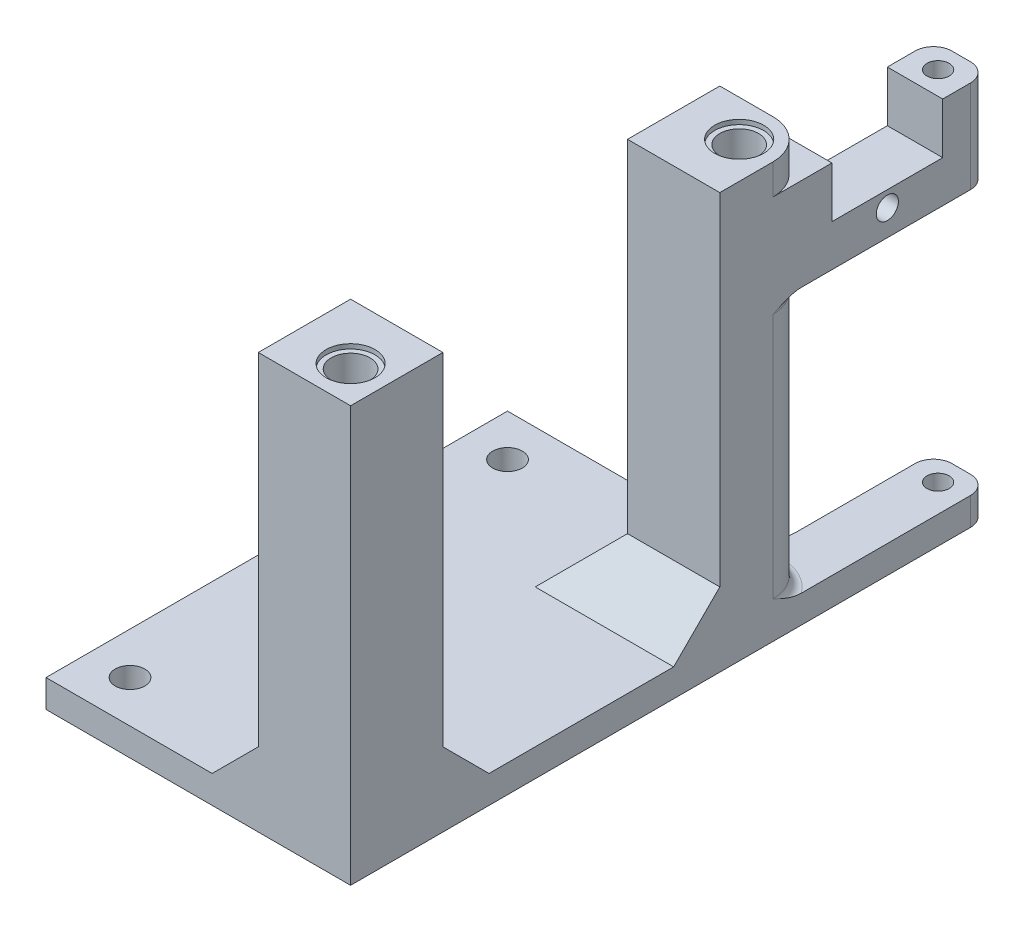
from build123d import *

# Parameters (mm, degrees)
SKETCH1_R           = 1.5999999999999974
SKETCH1_R_2         = 1.6
BOSS_EXTRUDE1_DEPTH = 3
SKETCH2_W           = 10.000000000000004
SKETCH2_H           = 10.000000000000004
BOSS_EXTRUDE2_DEPTH = 42
CHAMFER1_SIZE       = 5
SKETCH3_R           = 2.1
SKETCH3_R_2         = 2.1000000000000005
CUT_EXTRUDE1_DEPTH  = 52.00000000000001
SKETCH4_R           = 2.65
SKETCH4_R_2         = 2.6500000000000004
CUT_EXTRUDE2_DEPTH  = 0.5
BOSS_EXTRUDE3_DEPTH = 14.15
SKETCH6_R           = 1.2000000000000004
CUT_EXTRUDE3_DEPTH  = 6
SKETCH7_W           = 6
SKETCH7_H           = 10.018921584932333
BOSS_EXTRUDE4_DEPTH = 5
BOSS_EXTRUDE5_DEPTH = 2.15
SKETCH9_W           = 6
SKETCH9_H           = 3
BOSS_EXTRUDE6_DEPTH = 19.15
SKETCH10_R          = 1.2000000000000004
CUT_EXTRUDE4_DEPTH  = 64.7666045986287
FILLET3_R           = 2
FILLET4_R           = 4.25
FILLET5_R           = 4.25
FILLET6_R           = 4.25
FILLET7_R           = 4.25
FILLET8_R           = 1
FILLET9_R           = 1


with BuildPart() as part:
    # Sketch1 → Boss-Extrude1 (new body)
    with BuildSketch(Plane(origin=(0, 0, 0), x_dir=(1, 0, 0), z_dir=(0, 1, 0))):
        Polygon((-6.5123966942148765, 9.68595041322314), (1.487603305785124, 9.68595041322314), (26.48760330578513, 9.68595041322314), (26.487603305785132, -40.31404958677687), (1.4876033057851312, -40.31404958677687), (-6.512396694214871, -40.31404958677687), align=None)
        with Locations(Location((-1.962396694214872, -35.76404958677687, 0), (0, 0, 270))):
            Circle(SKETCH1_R, mode=Mode.SUBTRACT)
        with Locations(Location((-1.9623966942148756, 5.135950413223139, 0), (0, 0, 270))):
            Circle(SKETCH1_R_2, mode=Mode.SUBTRACT)
    extrude(amount=BOSS_EXTRUDE1_DEPTH)

    # Sketch2 → Boss-Extrude2 (add)
    with BuildSketch(Plane(origin=(0, 3, 0), x_dir=(1, 0, 0), z_dir=(0, 1, 0))):
        with Locations((21.48760330578513, -35.31404958677687)):
            Rectangle(SKETCH2_W, SKETCH2_H)
        Polygon((26.48760330578513, 9.68595041322314), (16.48760330578513, 9.685950413223138), (16.487603305785125, -0.314049586776863), (26.48760330578513, -0.31404958677686173), align=None)
    extrude(amount=BOSS_EXTRUDE2_DEPTH)

    # Chamfer1
    chamfer1_edges = [part.edges().sort_by_distance(p)[0] for p in [
        (21.48760330578513, 3, 30.314049586776864),
        (16.48760330578513, 3, 35.31404958677687),
        (16.48760330578513, 3, -4.6859504132231375),
        (21.48760330578513, 3, 0.31404958677686234),
    ]]
    chamfer(chamfer1_edges, length=CHAMFER1_SIZE)

    # Sketch3 → Cut-Extrude1 (cut)
    with BuildSketch(Plane(origin=(0, 45.00000000000001, 0), x_dir=(1, 0, 0), z_dir=(0, 1, 0))):
        with Locations(Location((22.53760330578513, -36.364049586776865, 0), (0, 0, 270))):
            Circle(SKETCH3_R)
        with Locations(Location((22.53760330578513, 5.735950413223138, 0), (0, 0, 270))):
            Circle(SKETCH3_R_2)
    extrude(amount=-CUT_EXTRUDE1_DEPTH, mode=Mode.SUBTRACT)

    # Sketch4 → Cut-Extrude2 (cut)
    with BuildSketch(Plane(origin=(0, 45.00000000000001, 0), x_dir=(1, 0, 0), z_dir=(0, 1, 0))):
        with Locations(Location((22.53760330578513, -36.364049586776865, 0), (0, 0, 270))):
            Circle(SKETCH4_R)
        with Locations(Location((22.53760330578513, 5.735950413223138, 0), (0, 0, 270))):
            Circle(SKETCH4_R_2)
    cut_extrude2 = extrude(amount=-CUT_EXTRUDE2_DEPTH, mode=Mode.SUBTRACT)

    # Mirror1: Cut-Extrude2 across plane
    add(cut_extrude2.mirror(Plane(origin=(0, 22.500000000000004, 0), x_dir=(0, 0, 1), z_dir=(0, -1, 0))), mode=Mode.SUBTRACT)

    # Sketch5 → Boss-Extrude3 (add)
    with BuildSketch(Plane(origin=(0, 0, -9.68595041322314), x_dir=(-1, 0, 0), z_dir=(0, 0, -1))):
        Polygon((-20.487603305785136, 36.20000000000077), (-26.487603305785136, 36.20000000000077), (-26.487603305785132, 31.68676314830412), (-20.487603305785132, 31.68676314830412), align=None)
    extrude(amount=BOSS_EXTRUDE3_DEPTH)

    # Sketch6 → Cut-Extrude3 (cut)
    with BuildSketch(Plane(origin=(26.48760330578513, 0, -1.84e-15), x_dir=(0, 0, -1), z_dir=(1, -7.7e-16, 0))):
        with Locations(Location((17.835950413222832, 34.50000000000082, 0), (0, 0, 90))):
            Circle(SKETCH6_R)
    extrude(amount=-CUT_EXTRUDE3_DEPTH, mode=Mode.SUBTRACT)

    # Sketch7 → Boss-Extrude4 (add)
    with BuildSketch(Plane(origin=(1.35e-15, 1.098e-14, -23.835950413222633), x_dir=(-1, 0, -6e-17), z_dir=(6e-17, 4.6e-16, -1))):
        with Locations((-23.487603305785132, 36.696223940770274)):
            Rectangle(SKETCH7_W, SKETCH7_H)
    extrude(amount=BOSS_EXTRUDE4_DEPTH)

    # Sketch8 → Boss-Extrude5 (add)
    with BuildSketch(Plane(origin=(0, 0, -9.68595041322314), x_dir=(-1, 0, 0), z_dir=(0, 0, -1))):
        Polygon((-26.487603305785136, 36.20000000000077), (-18.268679093182527, 36.2000000000008), (-18.268679093182527, 41.70568473323645), (-26.487603305785136, 41.70568473323645), align=None)
    extrude(amount=BOSS_EXTRUDE5_DEPTH)

    # Sketch9 → Boss-Extrude6 (add)
    with BuildSketch(Plane(origin=(0, 0, -9.68595041322314), x_dir=(-1, 0, 0), z_dir=(0, 0, -1))):
        with Locations((-23.487603305785132, 1.5)):
            Rectangle(SKETCH9_W, SKETCH9_H)
    extrude(amount=BOSS_EXTRUDE6_DEPTH)

    # Sketch10 → Cut-Extrude4 (cut, through all)
    with BuildSketch(Plane(origin=(0, 41.70568473323644, 1.921e-14), x_dir=(1, 0, 0), z_dir=(0, 1, 4.6e-16))):
        with Locations(Location((23.487603305785132, 26.335950413222633, 0), (0, 0, 270))):
            Circle(SKETCH10_R)
    extrude(amount=-CUT_EXTRUDE4_DEPTH, mode=Mode.SUBTRACT)

    # Fillet3
    fillet3_edges = [part.edges().sort_by_distance(p)[0] for p in [
        (26.487603305785132, 36.69622394077029, -28.835950413222616),
        (20.487603305785132, 36.69622394077029, -28.835950413222616),
        (20.487603305785132, 1.5, -28.835950413223138),
        (26.487603305785132, 1.5, -28.835950413223138),
    ]]
    fillet(fillet3_edges, radius=FILLET3_R)

    # Fillet4
    fillet4_edges = [part.edges().sort_by_distance(p)[0] for p in [
        (26.48760330578513, 17.343381574152062, -9.68595041322314),
    ]]
    fillet(fillet4_edges, radius=FILLET4_R)

    # Fillet5
    fillet5_edges = [part.edges().sort_by_distance(p)[0] for p in [
        (20.487603305785132, 1.5, -9.68595041322314),
    ]]
    fillet(fillet5_edges, radius=FILLET5_R)

    # Fillet6
    fillet6_edges = [part.edges().sort_by_distance(p)[0] for p in [
        (26.48760330578513, 43.352842366618226, -9.68595041322314),
    ]]
    fillet(fillet6_edges, radius=FILLET6_R)

    # Fillet7
    # the kernel refuses this fillet: 4.25 mm, written as the material it adds along each edge
    with BuildSketch(Plane(origin=(20.487603305785132, 31.68676314830412, -9.68595041322314), x_dir=(-1, 7.9e-16, 8.9e-16), z_dir=(7.9e-16, 1, 0))) as fillet7_piece_1:
        with BuildLine():
            CenterArc((4.2499999999999964, -4.242640687119286), FILLET7_R, 93.37228668343381, 86.62771331656613)
            Line((-3.77e-15, -4.242640687119282), (0, 0))
            Line((0, 0), (4.0000000000000036, 0))
        make_face()
    extrude(amount=4.51323685169665)
    with BuildSketch(Plane(origin=(20.48760330578512, 21.08016143050591, -9.68595041322314), x_dir=(-1, 7.9e-16, 0), z_dir=(7.9e-16, 1, 0))) as fillet7_piece_2_section:
        with BuildLine():
            CenterArc((4.2499999999999964, -4.242640687119284), FILLET7_R, 93.37228668343396, 86.62771331656604)
            Line((-3.55e-15, -4.242640687119284), (0, 0))
            Line((0, 0), (3.999999999999993, 0))
        make_face()
    fillet7_piece_2 = extrude(amount=25.726440287293073, mode=Mode.PRIVATE)
    fillet7_piece_2 = split(fillet7_piece_2, bisect_by=Plane(origin=(17.40856960112635, 36.2000000000008, -9.834246197287131), z_dir=(3.46e-15, 1, 0)), keep=Keep.TOP, mode=Mode.PRIVATE)
    fillet7_piece_2 = split(fillet7_piece_2, bisect_by=Plane(origin=(18.268679093182527, 38.95284236661862, -9.834246197287131), z_dir=(-1, 0, 0)), keep=Keep.TOP, mode=Mode.PRIVATE)
    fillet7_piece_2 = split(fillet7_piece_2, bisect_by=Plane(origin=(17.40856960112636, 41.70568473323645, -9.834246197287131), z_dir=(0, -1, 0)), keep=Keep.TOP, mode=Mode.PRIVATE)
    add(fillet7_piece_2)

    # Fillet8
    fillet8_edges = [part.edges().sort_by_distance(p)[0] for p in [
        (19.23760330578513, 3, -9.68595041322314),
        (25.242807125827955, 3, -8.441154233265967),
    ]]
    fillet(fillet8_edges, radius=FILLET8_R)

    # Fillet9
    # the kernel refuses this fillet: 1 mm, written as the material it adds along each edge
    with BuildSketch(Plane(origin=(22.23760330578513, 31.68676314830412, -9.68595041322314), x_dir=(2.101e-14, -1, 0), z_dir=(-1, -2.101e-14, 4.881e-14))) as fillet9_piece_1_section:
        with BuildLine():
            CenterArc((FILLET9_R, -FILLET9_R), FILLET9_R, 90, 90)
            Line((0, -FILLET9_R), (0, 0))
            Line((0, 0), (FILLET9_R, 0))
        make_face()
    fillet9_piece_1 = extrude(amount=5.750000000000124, mode=Mode.PRIVATE)
    fillet9_piece_1 = fillet9_piece_1 - Plane(origin=(16.237603305785, 31.449849305224696, -13.928591100342), x_dir=(-1, 0, 0), z_dir=(0, -1, 0)) * Cylinder(4.25, 16, mode=Mode.PRIVATE)
    add(fillet9_piece_1)
    with BuildSketch(Plane(origin=(22.23760330578513, 31.68676314830412, -5.43595041322314), x_dir=(0, 0, -1), z_dir=(-1, 0, 0))) as fillet9_piece_2_section:
        with BuildLine():
            CenterArc((4.249999999999999 + FILLET9_R, FILLET9_R), FILLET9_R, 180.00000000000693, 89.99999999999307)
            Line((4.249999999999999, FILLET9_R), (4.249999999999999, 0))
            Line((4.249999999999999, 0), (4.249999999999999 + FILLET9_R, 1.2079e-13))
        make_face()
    fillet9_piece_2 = revolve(axis=Axis((22.23760330578513, 31.68676314830412, -5.43595041322314), (0, -1, 0)), revolution_arc=123.71693864409282, mode=Mode.PRIVATE)
    fillet9_piece_2 = split(fillet9_piece_2, bisect_by=Plane(origin=(26.48760330578513, 31.521836885030236, -9.895455596994594), z_dir=(-1, 0, 7e-17)), keep=Keep.TOP, mode=Mode.PRIVATE)
    add(fillet9_piece_2)


solid = part.part
